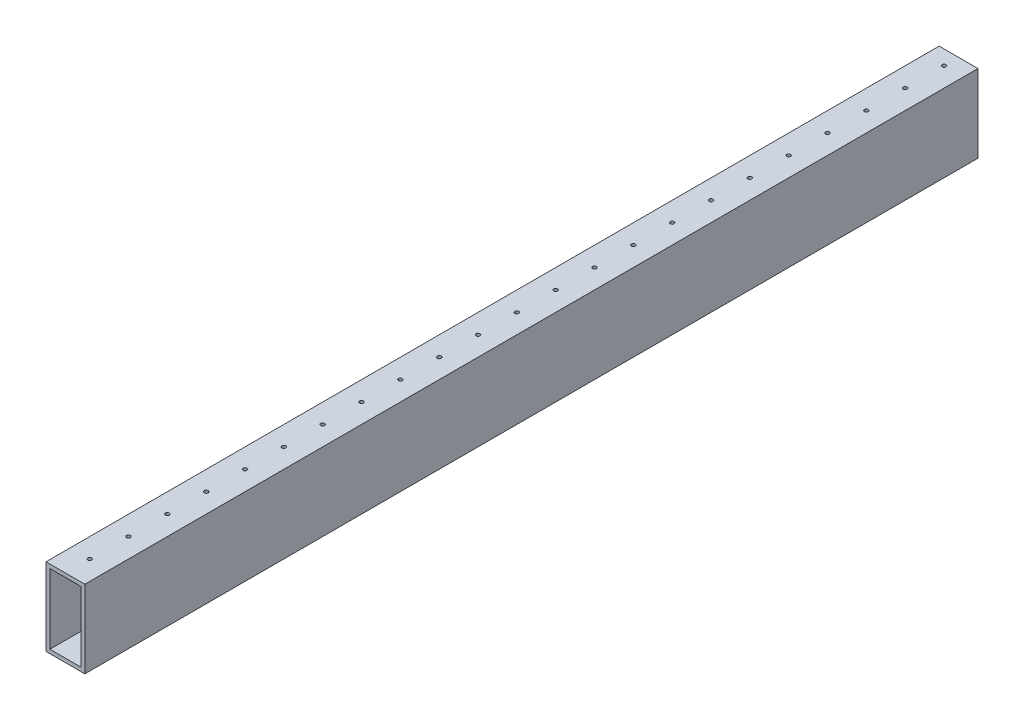
from build123d import *

# Parameters (mm, degrees)
SKETCH1_W           = 25.4
SKETCH1_H           = 50.8
SKETCH1_W_2         = 20.32
SKETCH1_H_2         = 45.72
EXTRUDE_THIN1_DEPTH = 292.1
SKETCH2_R           = 1.27
CUT_EXTRUDE1_DEPTH  = 297.756364717
LPATTERN1_COUNT     = 23
LPATTERN1_PITCH     = 25.4


with BuildPart() as part:
    # Sketch1 → Extrude-Thin1 (new, symmetric)
    with BuildSketch(Plane.XY):
        Rectangle(SKETCH1_W, SKETCH1_H)
        Rectangle(SKETCH1_W_2, SKETCH1_H_2, mode=Mode.SUBTRACT)
    extrude(amount=EXTRUDE_THIN1_DEPTH, both=True)

    # Sketch2 → Cut-Extrude1 (cut, through all)
    with BuildSketch(Plane(origin=(0, 25.4, 0), x_dir=(1, 0, 0), z_dir=(0, 1, 0))):
        with Locations((0, 282.575)):
            Circle(SKETCH2_R)
    cut_extrude1 = extrude(amount=-CUT_EXTRUDE1_DEPTH, mode=Mode.SUBTRACT)

    # LPattern1: Cut-Extrude1 ×23
    with Locations(*[(0, 0, i * LPATTERN1_PITCH) for i in range(1, LPATTERN1_COUNT)]):
        add(cut_extrude1, mode=Mode.SUBTRACT)


solid = part.part
